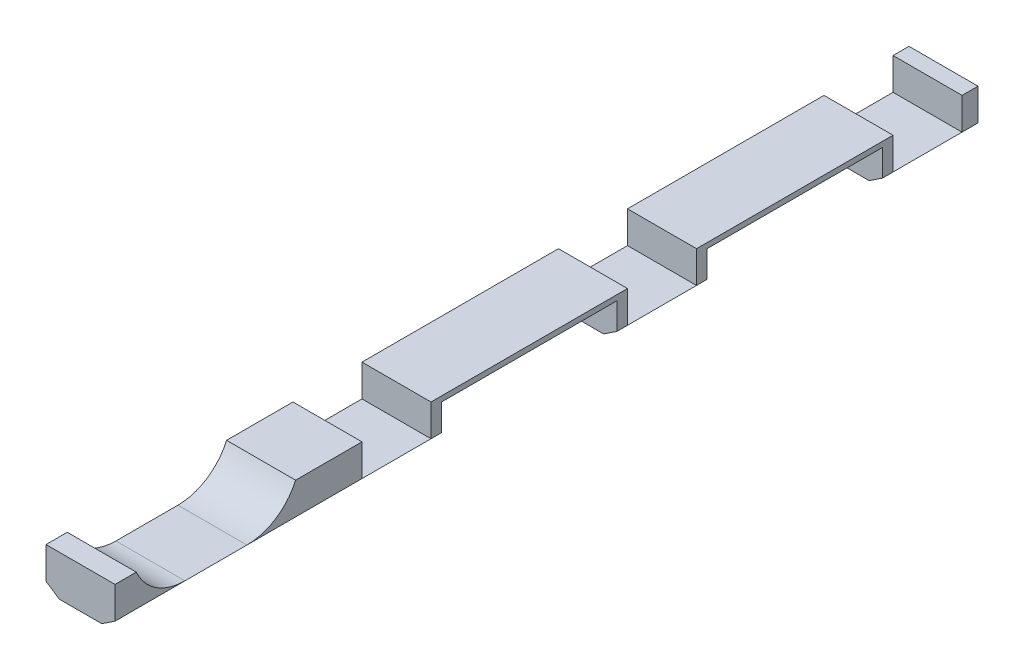
from build123d import *

# Parameters (mm, degrees)
BOSS_EXTRUDE1_DEPTH = 65
SKETCH2_W           = 5.2
SKETCH2_H           = 2.4
CUT_EXTRUDE1_DEPTH  = 6
LPATTERN1_COUNT     = 3
LPATTERN1_PITCH     = 20
SKETCH3_W           = 12
SKETCH3_H           = 2.4
CUT_EXTRUDE2_DEPTH  = 6
FILLET1_R           = 4
FILLET2_R           = 4
SKETCH5_W           = 13.2
SKETCH5_H           = 3.1
CUT_EXTRUDE3_DEPTH  = 10
LPATTERN2_COUNT     = 2
LPATTERN2_PITCH     = 20


with BuildPart() as part:
    # Sketch1 → Boss-Extrude1 (new body)
    with BuildSketch(Plane.XY):
        Polygon((0, 0), (3.2, 0), (4.2, 0.663324958), (4.2, 3.063324958), (-1, 3.063324958), (-1, 0.663324958), align=None)
    extrude(amount=BOSS_EXTRUDE1_DEPTH)

    # Sketch2 → Cut-Extrude1 (cut)
    with BuildSketch(Plane.ZY.offset(1)):
        with Locations((3.8, 1.863324958)):
            Rectangle(SKETCH2_W, SKETCH2_H)
    cut_extrude1 = extrude(amount=-CUT_EXTRUDE1_DEPTH, mode=Mode.SUBTRACT)

    # LPattern1: Cut-Extrude1 ×3
    with Locations(*[(0, 0, i * LPATTERN1_PITCH) for i in range(1, LPATTERN1_COUNT)]):
        add(cut_extrude1, mode=Mode.SUBTRACT)

    # Sketch3 → Cut-Extrude2 (cut)
    with BuildSketch(Plane.ZY.offset(1)):
        with Locations((57.4, 1.863324958)):
            Rectangle(SKETCH3_W, SKETCH3_H)
    extrude(amount=-CUT_EXTRUDE2_DEPTH, mode=Mode.SUBTRACT)

    # Fillet1
    # the kernel refuses this fillet: 4 mm, written as the material it adds along each edge
    with BuildSketch(Plane(origin=(-1, 0.663324958, 51.4), x_dir=(0, 0, 1), z_dir=(1, 0, 0))) as fillet1_piece_1_section:
        with BuildLine():
            CenterArc((3.666060556, -4), FILLET1_R, 90, 66.421821522)
            Line((0, -2.4), (-0.073321211, -2.368))
            ThreePointArc((-0.073321211, -2.368), (-0.08, -1.2), (-0.08, 0))
            Line((-0.08, 0), (0, 0.08))
            Line((0, 0.08), (3.666060556, 0.08))
            Line((3.666060556, 0.08), (3.666060556, 0))
        make_face()
    fillet1_piece_1 = extrude(amount=5.2, mode=Mode.PRIVATE)
    fillet1_piece_1 = split(fillet1_piece_1, bisect_by=Plane(origin=(0.518931728, -0.344220367, 52.290586237), z_dir=(0.5527707983925672, 0.833333333333333, 0)), keep=Keep.TOP, mode=Mode.PRIVATE)
    fillet1_piece_1 = split(fillet1_piece_1, bisect_by=Plane(origin=(2.681068272, -0.344220367, 52.290586237), z_dir=(-0.5527707983925666, 0.8333333333333335, 0)), keep=Keep.TOP, mode=Mode.PRIVATE)
    add(fillet1_piece_1)

    # Fillet2
    # the kernel refuses this fillet: 4 mm, written as the material it adds along each edge
    with BuildSketch(Plane(origin=(-1, 0.663324958, 63.4), x_dir=(0, 1, 0), z_dir=(1, 0, 0))) as fillet2_piece_1_section:
        with BuildLine():
            CenterArc((4, -3.666060556), FILLET2_R, 113.578178478, 66.421821522)
            Line((0, -3.666060556), (-0.08, -3.666060556))
            Line((-0.08, -3.666060556), (-0.08, 0))
            Line((-0.08, 0), (0, 0.08))
            ThreePointArc((0, 0.08), (1.2, 0.08), (2.368, 0.073321211))
            Line((2.368, 0.073321211), (2.4, 0))
        make_face()
    fillet2_piece_1 = extrude(amount=5.2, mode=Mode.PRIVATE)
    fillet2_piece_1 = split(fillet2_piece_1, bisect_by=Plane(origin=(2.681068272, -0.344220367, 62.509413763), z_dir=(-0.5527707983925666, 0.8333333333333335, 0)), keep=Keep.TOP, mode=Mode.PRIVATE)
    fillet2_piece_1 = split(fillet2_piece_1, bisect_by=Plane(origin=(0.518931728, -0.344220367, 62.509413763), z_dir=(0.5527707983925672, 0.833333333333333, 0)), keep=Keep.TOP, mode=Mode.PRIVATE)
    add(fillet2_piece_1)

    # Sketch5 → Cut-Extrude3 (cut)
    with BuildSketch(Plane.ZY.offset(1)):
        with Locations((13.8, 1.113324958)):
            Rectangle(SKETCH5_W, SKETCH5_H)
    cut_extrude3 = extrude(amount=-CUT_EXTRUDE3_DEPTH, mode=Mode.SUBTRACT)

    # LPattern2: Cut-Extrude3 ×2
    with Locations(*[(0, 0, i * LPATTERN2_PITCH) for i in range(1, LPATTERN2_COUNT)]):
        add(cut_extrude3, mode=Mode.SUBTRACT)


solid = part.part
